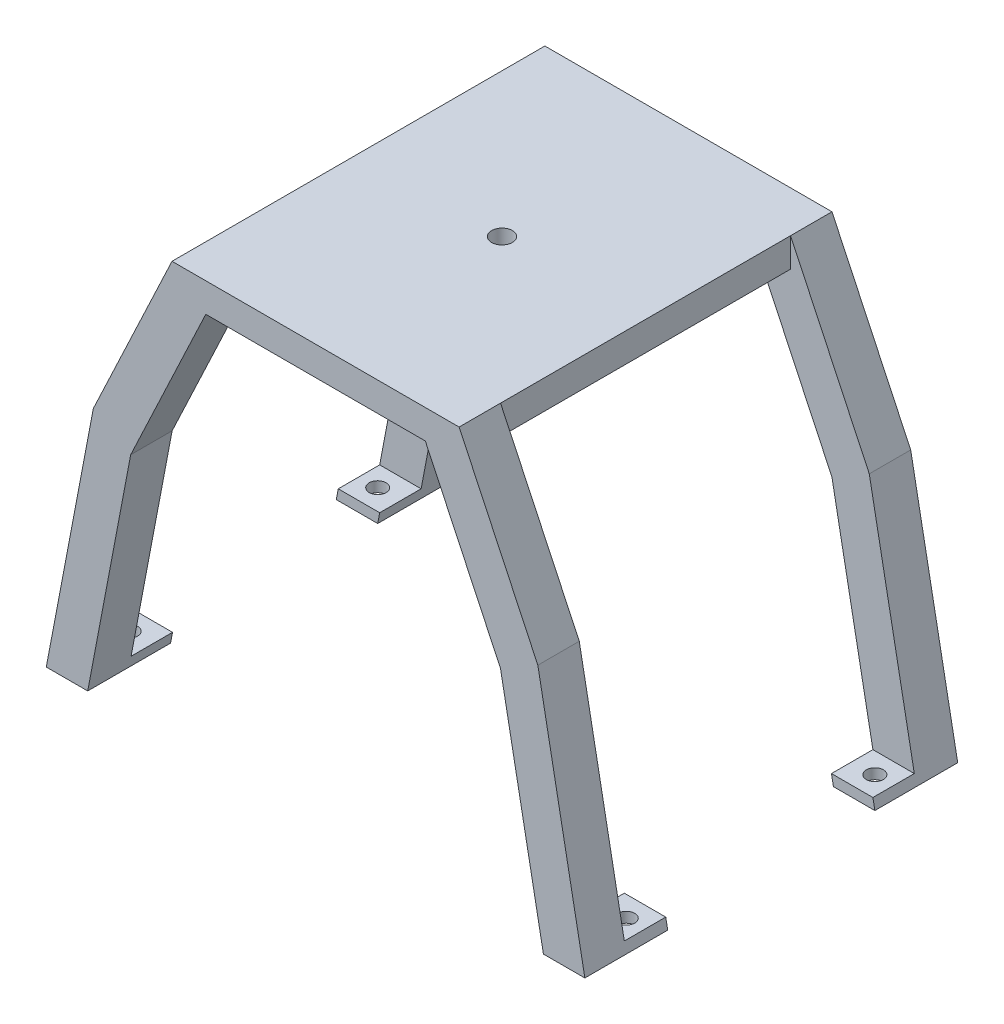
from build123d import *

# Parameters (mm, degrees)
BOSS_EXTRUDE1_DEPTH    = 10
LPATTERN1_COUNT        = 2
LPATTERN1_PITCH        = 80
SKETCH2_W              = 69.30058394
SKETCH2_H              = 90
BOSS_EXTRUDE2_DEPTH    = 7
SKETCH3_R              = 2.5
CUT_EXTRUDE1_DEPTH     = 10
BOSS_EXTRUDE3_DEPTH    = 77
CUT_EXTRUDE2_START     = -2.5
CUT_EXTRUDE2_OUTLINE_W = 20.397762745
CUT_EXTRUDE2_OUTLINE_H = 50
CUT_EXTRUDE2_OUTLINE_R = 2.05
CUT_EXTRUDE2_DEPTH     = 2.5


# Read off the part's stored shape, not the designer's step: Cut-Extrude2
with BuildPart() as part:
    # Sketch1 → Boss-Extrude1 (new body)
    with BuildSketch(Plane.XY):
        Polygon((0, 0), (11.349310372, 59.718827606), (30.34970803, 100), (99.65029197, 100), (118.650689628, 59.718827606), (130, 0), (120, 0), (109.631710362, 54.556803995), (91.49827561, 93), (38.50172439, 93), (20.368289638, 54.556803995), (10, 0), align=None)
    extrude(amount=BOSS_EXTRUDE1_DEPTH)


with BuildPart() as lpattern1_1:
    # LPattern1: pattern copy
    add(part.part.moved(Location(Vector(0, 0, -1) * (1 * LPATTERN1_PITCH))))


with BuildPart() as part_1:
    add(part.part)

    add(lpattern1_1.part)  # Boss-Extrude2 merges LPattern1_1
    # Sketch2 → Boss-Extrude2 (add)
    with BuildSketch(Plane(origin=(0, 100, 0), x_dir=(1, 0, 0), z_dir=(0, 1, 0))):
        with Locations((65, 35)):
            Rectangle(SKETCH2_W, SKETCH2_H)
    extrude(amount=-BOSS_EXTRUDE2_DEPTH)

    # Sketch3 → Cut-Extrude1 (cut)
    with BuildSketch(Plane.XZ.offset(-93)):
        with Locations(Location((65, -35, 0), (0, 0, 270))):
            Circle(SKETCH3_R)
    extrude(amount=-CUT_EXTRUDE1_DEPTH, mode=Mode.SUBTRACT)

    # Sketch4 → Boss-Extrude3 (add)
    with BuildSketch(Plane.XY.offset(-70)):
        Polygon((130, 0), (129.524885584, 2.5), (119.524885584, 2.5), (120, 0), align=None)
        Polygon((0, 0), (10, 0), (10.475114416, 2.5), (0.475114416, 2.5), align=None)
    extrude(amount=BOSS_EXTRUDE3_DEPTH)

    # Cut-Extrude2 outline → Cut-Extrude2 (cut)
    with BuildSketch(Plane(origin=(0, 2.5, 0), x_dir=(1, 0, 0), z_dir=(0, 1, 0)).offset(CUT_EXTRUDE2_START)):
        with Locations((129.723766957, 35)):
            Rectangle(CUT_EXTRUDE2_OUTLINE_W, CUT_EXTRUDE2_OUTLINE_H)
        with Locations((0.276233043, 35)):
            Rectangle(CUT_EXTRUDE2_OUTLINE_W, CUT_EXTRUDE2_OUTLINE_H)
        with Locations((125, 65)):
            Circle(CUT_EXTRUDE2_OUTLINE_R)
        with Locations((125, 5)):
            Circle(CUT_EXTRUDE2_OUTLINE_R)
        with Locations((5, 5)):
            Circle(CUT_EXTRUDE2_OUTLINE_R)
        with Locations((5, 65)):
            Circle(CUT_EXTRUDE2_OUTLINE_R)
    extrude(amount=CUT_EXTRUDE2_DEPTH, mode=Mode.SUBTRACT)


solid = part_1.part
